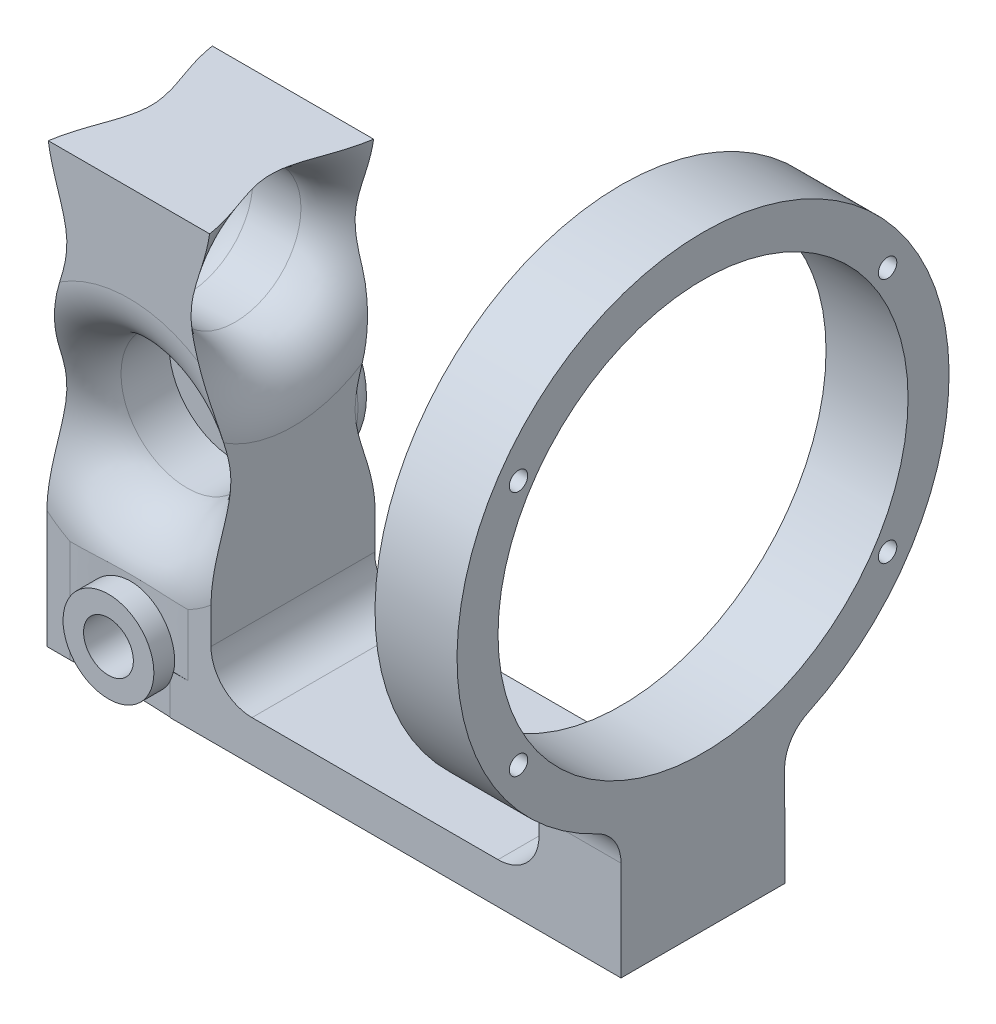
from build123d import *

# Parameters (mm, degrees)
SKETCH1_W                = 40
SKETCH1_H                = 60
SKETCH1_R                = 11.05
BOSS_EXTRUDE1_DEPTH      = 40
SKETCH2_R                = 11.05
CUT_EXTRUDE1_DEPTH       = 40
FILLET1_R                = 4
SKETCH3_W                = 60
SKETCH3_H                = 60
BOSS_EXTRUDE2_DEPTH      = 7
CHAMFER1_SIZE            = 1.75
SKETCH6_W                = 71.847472101
SKETCH6_H                = 65.672512416
SKETCH6_W_2              = 40
SKETCH6_H_2              = 40
CUT_EXTRUDE3_DEPTH       = 100
SKETCH7_R                = 16.05
CUT_EXTRUDE4_DEPTH       = 100
FILLET2_R                = 15
SKETCH14_W               = 40
SKETCH14_H               = 40
BOSS_EXTRUDE5_DEPTH      = 15
SKETCH15_R               = 16.05
CUT_EXTRUDE7_DEPTH       = 100
FILLET3_R                = 15
BOSS_EXTRUDE7_DEPTH      = 25
CUT_EXTRUDE11_DEPTH      = 10
CUT_EXTRUDE12_DEPTH      = 10
CUT_EXTRUDE18_START      = -10
SKETCH23_R               = 6.05
CUT_EXTRUDE18_DEPTH      = 10
CUT_EXTRUDE19_START      = -10
SKETCH24_R               = 6.05
CUT_EXTRUDE19_DEPTH      = 10
BOSS_EXTRUDE8_START      = 80
SKETCH25_R               = 60
SKETCH25_R_2             = 50
BOSS_EXTRUDE8_DEPTH      = 20
BOSS_EXTRUDE9_DEPTH      = 20
BOSS_EXTRUDE11_DEPTH     = 110
SKETCH28_R               = 6.05
BOSS_EXTRUDE12_DEPTH     = 30
CUT_EXTRUDE20_DEPTH      = 179.902906706
CUT_EXTRUDE20_DEPTH_BACK = 20
SKETCH29_R               = 2.25
FILLET4_R                = 10
FILLET5_R                = 10
SKETCH30_W               = 4.417090553
SKETCH30_H               = 10
BOSS_EXTRUDE13_DEPTH     = 9.6
CUT_EXTRUDE21_START      = -50
SKETCH31_R               = 16.075
SKETCH31_R_2             = 16.05
CUT_EXTRUDE21_DEPTH      = 50
SKETCH32_R               = 16.075
SKETCH32_R_2             = 16.05
CUT_EXTRUDE22_DEPTH      = 50
SKETCH34_R               = 20
BOSS_EXTRUDE22_DEPTH     = 15
FILLET7_R                = 5
SKETCH45_R               = 6.075
CUT_EXTRUDE24_DEPTH      = 10
SKETCH46_R               = 6.075
CUT_EXTRUDE25_DEPTH      = 10
SKETCH48_R               = 11.075
SKETCH48_R_2             = 6.075
BOSS_EXTRUDE24_DEPTH     = 5
SKETCH49_R               = 11.075
SKETCH49_R_2             = 6.075
BOSS_EXTRUDE25_DEPTH     = 5


with BuildPart() as part:
    # Sketch1 → Boss-Extrude1 (new body)
    with BuildSketch(Plane.XY):
        Rectangle(SKETCH1_W, SKETCH1_H)
        with Locations((0, -17.5)):
            Circle(SKETCH1_R, mode=Mode.SUBTRACT)
    extrude(amount=BOSS_EXTRUDE1_DEPTH)

    # Sketch2 → Cut-Extrude1 (cut)
    with BuildSketch(Plane.ZY.offset(20)):
        with Locations((20, 17.5)):
            Circle(SKETCH2_R)
    extrude(amount=-CUT_EXTRUDE1_DEPTH, mode=Mode.SUBTRACT)

    # Fillet1
    # the kernel refuses this fillet: 4 mm, written as the material it takes off along each edge
    with BuildSketch(Plane(origin=(0, -17.5, 0), x_dir=(1, 0, 0), z_dir=(0, -1, 0))) as fillet1_piece_1:
        with BuildLine():
            CenterArc((11.05 + FILLET1_R, FILLET1_R), FILLET1_R, 180, 90)
            Line((11.05, FILLET1_R), (11.05, 0))
            Line((11.05, 0), (11.05 + FILLET1_R, 0))
        make_face()
    revolve(axis=Axis((0, -17.5, 0), (0, 0, 1)), mode=Mode.SUBTRACT)
    with BuildSketch(Plane(origin=(0, -17.5, 40), x_dir=(1, 0, 0), z_dir=(0, -1, 0))) as fillet1_piece_2:
        with BuildLine():
            CenterArc((11.05 + FILLET1_R, -FILLET1_R), FILLET1_R, 90, 90)
            Line((11.05, -FILLET1_R), (11.05, 0))
            Line((11.05, 0), (11.05 + FILLET1_R, 0))
        make_face()
    revolve(axis=Axis((0, -17.5, 40), (0, 0, 1)), mode=Mode.SUBTRACT)
    with BuildSketch(Plane(origin=(20, 17.5, 20), x_dir=(0, 0, 1), z_dir=(0, -1, 0))) as fillet1_piece_3:
        with BuildLine():
            CenterArc((11.05 + FILLET1_R, FILLET1_R), FILLET1_R, 180, 90)
            Line((11.05, FILLET1_R), (11.05, 0))
            Line((11.05, 0), (11.05 + FILLET1_R, 0))
        make_face()
    revolve(axis=Axis((20, 17.5, 20), (-1, 0, 0)), mode=Mode.SUBTRACT)
    with BuildSketch(Plane(origin=(-20, 17.5, 20), x_dir=(0, 0, 1), z_dir=(0, -1, 0))) as fillet1_piece_4:
        with BuildLine():
            CenterArc((11.05 + FILLET1_R, -FILLET1_R), FILLET1_R, 90, 90)
            Line((11.05, -FILLET1_R), (11.05, 0))
            Line((11.05, 0), (11.05 + FILLET1_R, 0))
        make_face()
    revolve(axis=Axis((-20, 17.5, 20), (-1, 0, 0)), mode=Mode.SUBTRACT)

    # Sketch3 → Boss-Extrude2 (add)
    with BuildSketch(Plane(origin=(0, 30, 0), x_dir=(1, 0, 0), z_dir=(0, 1, 0))):
        with Locations((-0.070613374, -20)):
            Rectangle(SKETCH3_W, SKETCH3_H)
    extrude(amount=BOSS_EXTRUDE2_DEPTH)

    # Chamfer1
    chamfer1_edges = [part.edges().sort_by_distance(p)[0] for p in [
        (-30.070613374, 37, 20),
        (-30.070613374, 33.5, -10),
        (-0.070613374, 37, 50),
        (-30.070613374, 33.5, 50),
        (29.929386626, 30, 20),
        (29.929386626, 33.5, 50),
        (-0.070613374, 30, -10),
        (29.929386626, 33.5, -10),
        (29.929386626, 37, 20),
        (-0.070613374, 37, -10),
        (-30.070613374, 30, 20),
        (-0.070613374, 30, 50),
    ]]
    chamfer(chamfer1_edges, length=CHAMFER1_SIZE)

    # Sketch6 → Cut-Extrude3 (cut)
    with BuildSketch(Plane(origin=(0, 30, 0), x_dir=(-1, 0, 0), z_dir=(0, -1, 0))):
        with Locations((0.669947696, -19.727575308)):
            Rectangle(SKETCH6_W, SKETCH6_H)
        with Locations((0, -20)):
            Rectangle(SKETCH6_W_2, SKETCH6_H_2, mode=Mode.SUBTRACT)
    extrude(amount=-CUT_EXTRUDE3_DEPTH, mode=Mode.SUBTRACT)

    # Sketch7 → Cut-Extrude4 (cut)
    with BuildSketch(Plane(origin=(20, 0, 0), x_dir=(0, 0, -1), z_dir=(1, 0, 0))):
        with Locations((-20, 17.5)):
            Circle(SKETCH7_R)
    extrude(amount=-CUT_EXTRUDE4_DEPTH, mode=Mode.SUBTRACT)

    # Fillet2
    # the kernel refuses this fillet: 15 mm, written as the material it takes off along each edge
    with BuildSketch(Plane(origin=(-20, 17.5, 20), x_dir=(0, 0, -1), z_dir=(0, -1, 0))) as fillet2_piece_1:
        with BuildLine():
            CenterArc((16.05 + FILLET2_R, FILLET2_R), FILLET2_R, 180, 90)
            Line((16.05, FILLET2_R), (16.05, 0))
            Line((16.05, 0), (16.05 + FILLET2_R, 0))
        make_face()
    revolve(axis=Axis((-20, 17.5, 20), (1, 0, 0)), mode=Mode.SUBTRACT)
    with BuildSketch(Plane(origin=(20, 17.5, 20), x_dir=(0, 0, -1), z_dir=(0, -1, 0))) as fillet2_piece_2:
        with BuildLine():
            CenterArc((16.05 + FILLET2_R, -FILLET2_R), FILLET2_R, 90, 90)
            Line((16.05, -FILLET2_R), (16.05, 0))
            Line((16.05, 0), (16.05 + FILLET2_R, 0))
        make_face()
    revolve(axis=Axis((20, 17.5, 20), (1, 0, 0)), mode=Mode.SUBTRACT)

    # Sketch14 → Boss-Extrude5 (add)
    with BuildSketch(Plane(origin=(0, -30, 0), x_dir=(-1, 0, 0), z_dir=(0, -1, 0))):
        with Locations((0, -20)):
            Rectangle(SKETCH14_W, SKETCH14_H)
    extrude(amount=BOSS_EXTRUDE5_DEPTH)

    # Sketch15 → Cut-Extrude7 (cut)
    with BuildSketch(Plane.XY.offset(40)):
        with Locations((0, -17.5)):
            Circle(SKETCH15_R)
    extrude(amount=-CUT_EXTRUDE7_DEPTH, mode=Mode.SUBTRACT)

    # Fillet3
    # the kernel refuses this fillet: 15 mm, written as the material it takes off along each edge
    with BuildSketch(Plane(origin=(0, -17.5, 0), x_dir=(1, 0, 0), z_dir=(0, -1, 0))) as fillet3_piece_1:
        with BuildLine():
            CenterArc((16.05 + FILLET3_R, FILLET3_R), FILLET3_R, 180, 90)
            Line((16.05, FILLET3_R), (16.05, 0))
            Line((16.05, 0), (16.05 + FILLET3_R, 0))
        make_face()
    revolve(axis=Axis((0, -17.5, 0), (0, 0, 1)), mode=Mode.SUBTRACT)
    with BuildSketch(Plane(origin=(0, -17.5, 40), x_dir=(1, 0, 0), z_dir=(0, -1, 0))) as fillet3_piece_2:
        with BuildLine():
            CenterArc((16.05 + FILLET3_R, -FILLET3_R), FILLET3_R, 90, 90)
            Line((16.05, -FILLET3_R), (16.05, 0))
            Line((16.05, 0), (16.05 + FILLET3_R, 0))
        make_face()
    revolve(axis=Axis((0, -17.5, 40), (0, 0, 1)), mode=Mode.SUBTRACT)

    # Sketch20 → Boss-Extrude7 (add)
    with BuildSketch(Plane(origin=(0, -45, 0), x_dir=(-1, 0, 0), z_dir=(0, -1, 0))):
        with BuildLine():
            Line((20, -40), (20, 0))
            Line((20, 0), (14.417090553, 0))
            add(Edge.make_bspline(
                [(-14.417090553, 0), (-13.777993603, 0), (-13.138892601, -0.006848897), (-12.499860402, -0.01954665), (-11.860939979, -0.037102007), (-11.222144558, -0.058535782), (-10.58345793, -0.082890476), (-9.654244083, -0.121238874), (-9.363668398, -0.133645717), (-9.073104811, -0.146380094), (-8.782550069, -0.159356819), (-8.492000739, -0.172492589), (-8.201453228, -0.185706338), (-7.352403535, -0.224318407), (-6.793898266, -0.249715283), (-6.235360003, -0.274553324), (-5.676766793, -0.298310561), (-5.118103261, -0.320512147), (-4.559361146, -0.34074253), (-3.432648883, -0.37686351), (-2.864675014, -0.392678358), (-2.296623287, -0.405740973), (-1.728504493, -0.415765857), (-1.160335426, -0.422556629), (-0.592139057, -0.426013358), (0.965051738, -0.426343628), (1.954074482, -0.416445624), (2.942941741, -0.396427111), (3.931551118, -0.367168555), (4.919878276, -0.330448341), (5.907968306, -0.288686867), (7.472005816, -0.219112227), (8.04803879, -0.192742208), (8.624058691, -0.166194789), (9.200094044, -0.14008507), (9.776170982, -0.115065844), (10.352312722, -0.091816637), (11.426732093, -0.053063412), (11.924982467, -0.036937202), (12.423302441, -0.023104461), (12.921691953, -0.012025154), (13.420138534, -0.004166397), (13.918617235, 0), (14.417090553, 0)],
                knots=[0, 0, 0, 0, 0, 0, 0, 0, 0.155091889, 0.155091889, 0.155091889, 0.155091889, 0.155091889, 0.155091889, 0.225662919, 0.225662919, 0.225662919, 0.225662919, 0.225662919, 0.225662919, 0.361316046, 0.361316046, 0.361316046, 0.361316046, 0.361316046, 0.361316046, 0.499170821, 0.499170821, 0.499170821, 0.499170821, 0.499170821, 0.499170821, 0.739120143, 0.739120143, 0.739120143, 0.739120143, 0.739120143, 0.739120143, 0.879033704, 0.879033704, 0.879033704, 0.879033704, 0.879033704, 0.879033704, 1, 1, 1, 1, 1, 1, 1, 1], degree=7))
            Line((-14.417090553, 0), (-20, 0))
            Line((-20, 0), (-20, -40))
            Line((-20, -40), (-14.417090553, -40))
            add(Edge.make_bspline(
                [(14.417090553, -40), (13.777993603, -40), (13.138892601, -39.993151103), (12.499860402, -39.98045335), (11.860939979, -39.962897993), (11.222144558, -39.941464218), (10.58345793, -39.917109524), (9.654244083, -39.878761126), (9.363668398, -39.866354283), (9.073104811, -39.853619906), (8.782550069, -39.840643181), (8.492000739, -39.827507411), (8.201453228, -39.814293662), (7.352403535, -39.775681593), (6.793898266, -39.750284717), (6.235360003, -39.725446676), (5.676766793, -39.701689439), (5.118103261, -39.679487853), (4.559361146, -39.65925747), (3.432648883, -39.62313649), (2.864675014, -39.607321642), (2.296623287, -39.594259027), (1.728504493, -39.584234143), (1.160335426, -39.577443371), (0.592139057, -39.573986642), (-0.965051738, -39.573656372), (-1.954074482, -39.583554376), (-2.942941741, -39.603572889), (-3.931551118, -39.632831445), (-4.919878276, -39.669551659), (-5.907968306, -39.711313133), (-7.472005816, -39.780887773), (-8.04803879, -39.807257792), (-8.624058691, -39.833805211), (-9.200094044, -39.85991493), (-9.776170982, -39.884934156), (-10.352312722, -39.908183363), (-11.426732093, -39.946936588), (-11.924982467, -39.963062798), (-12.423302441, -39.976895539), (-12.921691953, -39.987974846), (-13.420138534, -39.995833603), (-13.918617235, -40), (-14.417090553, -40)],
                knots=[0, 0, 0, 0, 0, 0, 0, 0, 0.155091889, 0.155091889, 0.155091889, 0.155091889, 0.155091889, 0.155091889, 0.225662919, 0.225662919, 0.225662919, 0.225662919, 0.225662919, 0.225662919, 0.361316046, 0.361316046, 0.361316046, 0.361316046, 0.361316046, 0.361316046, 0.499170821, 0.499170821, 0.499170821, 0.499170821, 0.499170821, 0.499170821, 0.739120143, 0.739120143, 0.739120143, 0.739120143, 0.739120143, 0.739120143, 0.879033704, 0.879033704, 0.879033704, 0.879033704, 0.879033704, 0.879033704, 1, 1, 1, 1, 1, 1, 1, 1], degree=7))
            Line((14.417090553, -40), (20, -40))
        make_face()
    extrude(amount=BOSS_EXTRUDE7_DEPTH)

    # Sketch21 → Cut-Extrude11 (cut)
    with BuildSketch(Plane.XY.offset(40)):
        with BuildLine():
            Line((0, -63.55), (0, -57.5))
            Line((0, -57.5), (0, -51.45))
            ThreePointArc((0, -51.45), (-6.05, -57.5), (0, -63.55))
        make_face()
        with BuildLine():
            Line((0, -51.45), (0, -57.5))
            Line((0, -57.5), (0, -63.55))
            ThreePointArc((0, -63.55), (4.277996026, -61.777996026), (6.05, -57.5))
            ThreePointArc((6.05, -57.5), (4.277996026, -53.222003974), (0, -51.45))
        make_face()
    extrude(amount=-CUT_EXTRUDE11_DEPTH, mode=Mode.SUBTRACT)

    # Sketch22 → Cut-Extrude12 (cut)
    with BuildSketch(Plane(origin=(20, 0, 0), x_dir=(0, 0, -1), z_dir=(1, 0, 0))):
        with BuildLine():
            ThreePointArc((-13.95, -57.5), (-15.722003974, -53.222003974), (-20, -51.45))
            Line((-20, -51.45), (-20, -57.5))
            Line((-20, -57.5), (-13.95, -57.5))
        make_face()
        with BuildLine():
            Line((-20, -57.5), (-20, -51.45))
            ThreePointArc((-20, -51.45), (-24.277996026, -61.777996026), (-13.95, -57.5))
            Line((-13.95, -57.5), (-20, -57.5))
        make_face()
    extrude(amount=-CUT_EXTRUDE12_DEPTH, mode=Mode.SUBTRACT)

    # Sketch23 → Cut-Extrude18 (cut)
    with BuildSketch(Plane(origin=(0, 0, 0), x_dir=(-1, 0, 0), z_dir=(0, 0, -1)).offset(CUT_EXTRUDE18_START)):
        with Locations(Location((0, -57.5, 0), (0, 0, 180))):
            Circle(SKETCH23_R)
    extrude(amount=CUT_EXTRUDE18_DEPTH, mode=Mode.SUBTRACT)

    # Sketch24 → Cut-Extrude19 (cut)
    with BuildSketch(Plane.ZY.offset(20).offset(CUT_EXTRUDE19_START)):
        with Locations(Location((20, -57.5, 0), (0, 0, 180))):
            Circle(SKETCH24_R)
    extrude(amount=CUT_EXTRUDE19_DEPTH, mode=Mode.SUBTRACT)



with BuildPart() as body_2:
    # Sketch25 → Boss-Extrude8 (new body)
    with BuildSketch(Plane(origin=(20, 0, 0), x_dir=(0, 0, -1), z_dir=(1, 0, 0)).offset(BOSS_EXTRUDE8_START)):
        with Locations((-20, 17.5)):
            Circle(SKETCH25_R)
        with Locations((-20, 17.5)):
            Circle(SKETCH25_R_2, mode=Mode.SUBTRACT)
    extrude(amount=BOSS_EXTRUDE8_DEPTH)

    # Sketch26 → Boss-Extrude9 (add)
    with BuildSketch(Plane(origin=(120, 0, 0), x_dir=(0, 0, -1), z_dir=(1, 0, 0))):
        Polygon((-40, -70), (0, -70), (-0.145184354, -38.449210343), (-40, -38.449210343), align=None)
    extrude(amount=-BOSS_EXTRUDE9_DEPTH)


with BuildPart() as part_1:
    add(part.part)

    add(body_2.part)  # Boss-Extrude11 merges body 2
    # Sketch27 → Boss-Extrude11 (add)
    with BuildSketch(Plane(origin=(120, 0, 0), x_dir=(0, 0, -1), z_dir=(1, 0, 0))):
        Polygon((-40, -60), (-0.046016076, -60), (0, -70), (-40, -70), align=None)
    extrude(amount=-BOSS_EXTRUDE11_DEPTH)

    # Sketch28 → Boss-Extrude12 (add)
    with BuildSketch(Plane(origin=(20, 0, 0), x_dir=(0, 0, -1), z_dir=(1, 0, 0))):
        with Locations(Location((-20, -57.5, 0), (0, 0, 180))):
            Circle(SKETCH28_R)
    extrude(amount=-BOSS_EXTRUDE12_DEPTH)

    # Sketch29 → Cut-Extrude20 (cut, two sides: drawn at the far end of the back side and taken through both)
    with BuildSketch(Plane(origin=(120, 0, 0), x_dir=(0, 0, -1), z_dir=(1, 0, 0)).offset(-CUT_EXTRUDE20_DEPTH_BACK)):
        with Locations(Location((-65, 47.5, 0), (0, 0, 180))):
            Circle(SKETCH29_R)
        with Locations(Location((25, 47.5, 0), (0, 0, 180))):
            Circle(SKETCH29_R)
        with Locations(Location((25, -12.5, 0), (0, 0, 180))):
            Circle(SKETCH29_R)
        with Locations(Location((-65, -12.5, 0), (0, 0, 180))):
            Circle(SKETCH29_R)
    extrude(amount=CUT_EXTRUDE20_DEPTH + CUT_EXTRUDE20_DEPTH_BACK, mode=Mode.SUBTRACT)

    # Fillet4
    fillet4_edges = [part_1.edges().sort_by_distance(p)[0] for p in [
        (100, -60, 20.023008038),
        (110, -39.068542495, 40),
        (110, -39.118583282, 0.142104162),
    ]]
    fillet(fillet4_edges, radius=FILLET4_R)

    # Fillet5
    fillet5_edges = [part_1.edges().sort_by_distance(p)[0] for p in [
        (20, -60, 20.023008038),
    ]]
    fillet(fillet5_edges, radius=FILLET5_R)

    # Sketch30 → Boss-Extrude13 (add)
    with BuildSketch(Plane(origin=(0, 0, 0), x_dir=(-1, 0, 0), z_dir=(0, 0, -1))):
        with Locations((-12.208545277, -65)):
            Rectangle(SKETCH30_W, SKETCH30_H)
    extrude(amount=-BOSS_EXTRUDE13_DEPTH)

    # Sketch31 → Cut-Extrude21 (cut)
    with BuildSketch(Plane(origin=(0, 0, 0), x_dir=(-1, 0, 0), z_dir=(0, 0, -1)).offset(CUT_EXTRUDE21_START)):
        with Locations((0, -17.5)):
            Circle(SKETCH31_R)
        with Locations((0, -17.5)):
            Circle(SKETCH31_R_2, mode=Mode.SUBTRACT)
    extrude(amount=CUT_EXTRUDE21_DEPTH, mode=Mode.SUBTRACT)

    # Sketch32 → Cut-Extrude22 (cut)
    with BuildSketch(Plane(origin=(20, 0, 0), x_dir=(0, 0, -1), z_dir=(1, 0, 0))):
        with Locations((-20, 17.5)):
            Circle(SKETCH32_R)
        with Locations((-20, 17.5)):
            Circle(SKETCH32_R_2, mode=Mode.SUBTRACT)
    extrude(amount=-CUT_EXTRUDE22_DEPTH, mode=Mode.SUBTRACT)

    # Sketch34 → Boss-Extrude22 (add)
    with BuildSketch(Plane.XY.offset(14.134335515)):
        with Locations((0, -17.5)):
            Circle(SKETCH34_R)
    extrude(amount=-BOSS_EXTRUDE22_DEPTH)

    # Fillet7
    fillet7_edges = [part_1.edges().sort_by_distance(p)[0] for p in [
        (-20, -17.5, -0.865664485),
    ]]
    fillet(fillet7_edges, radius=FILLET7_R)

    # Sketch45 → Cut-Extrude24 (cut)
    with BuildSketch(Plane.XY.offset(30)):
        with Locations(Location((0, -57.5, 0), (0, 0, 180))):
            Circle(SKETCH45_R)
    extrude(amount=CUT_EXTRUDE24_DEPTH, mode=Mode.SUBTRACT)

    # Sketch46 → Cut-Extrude25 (cut)
    with BuildSketch(Plane.ZY.offset(10)):
        with Locations((20, -57.5)):
            Circle(SKETCH46_R)
    extrude(amount=CUT_EXTRUDE25_DEPTH, mode=Mode.SUBTRACT)

    # Sketch48 → Boss-Extrude24 (add, symmetric)
    with BuildSketch(Plane.XY.offset(40)):
        with Locations(Location((0, -57.5, 0), (0, 0, 334.546520904))):
            Circle(SKETCH48_R)
        with Locations((0, -57.5)):
            Circle(SKETCH48_R_2, mode=Mode.SUBTRACT)
    extrude(amount=BOSS_EXTRUDE24_DEPTH, both=True)

    # Sketch49 → Boss-Extrude25 (add, symmetric)
    with BuildSketch(Plane.ZY.offset(20)):
        with Locations(Location((20, -57.5, 0), (0, 0, 180))):
            Circle(SKETCH49_R)
        with Locations((20, -57.5)):
            Circle(SKETCH49_R_2, mode=Mode.SUBTRACT)
    extrude(amount=BOSS_EXTRUDE25_DEPTH, both=True)


solid = part_1.part
